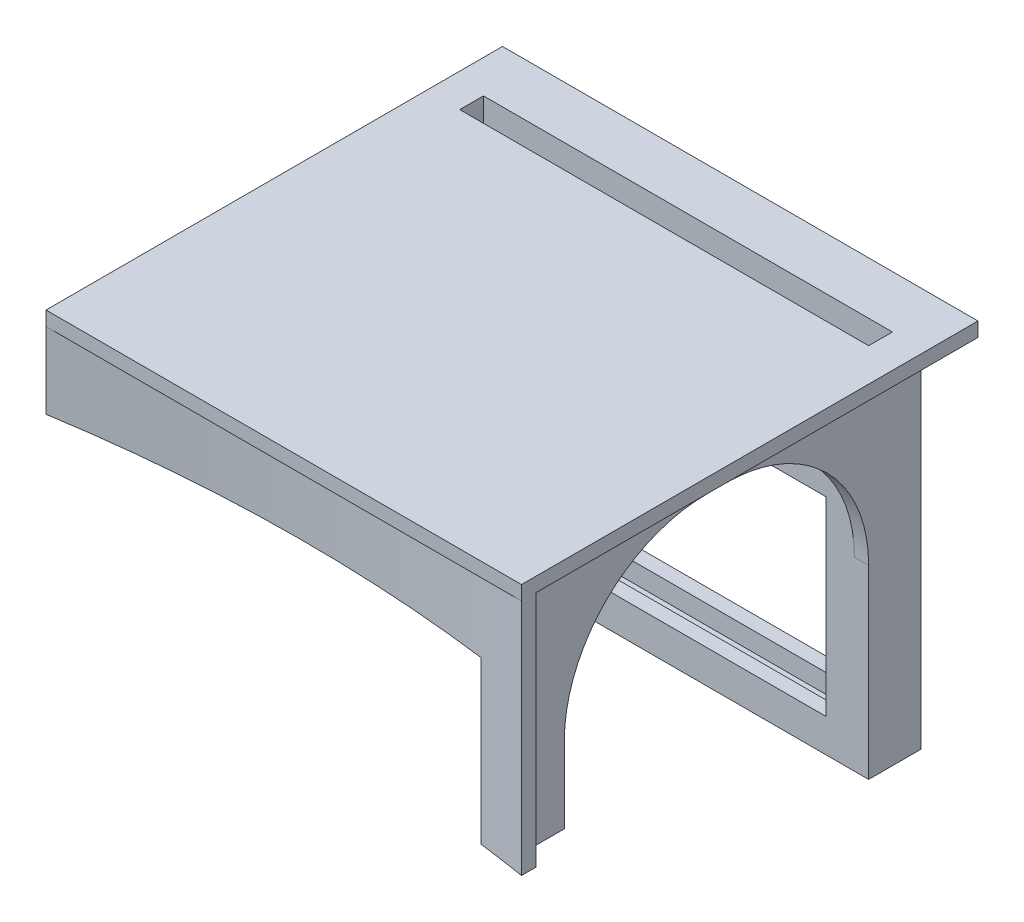
from build123d import *

# Parameters (mm, degrees)
SKETCH_1_W          = 50
SKETCH_1_H          = 48
SKETCH_1_W_2        = 43
SKETCH_1_H_2        = 2.5
EXTRUDE_1_DEPTH     = 1.5
SKETCH_2_W          = 46
SKETCH_2_H          = 5.5
SKETCH_2_W_2        = 43
SKETCH_2_H_2        = 2.5
EXTRUDE_2_DEPTH     = 35
SKETCH_3_W          = 46
SKETCH_3_H          = 5.5
EXTRUDE_3_DEPTH     = 1.5
SKETCH_4_W          = 37
SKETCH_4_H          = 20
CUT_EXTRUDE_1_DEPTH = 5.5
EXTRUDE_4_DEPTH     = 25
EXTRUDE_5_DEPTH     = 1.5
CUT_EXTRUDE_2_REACH = 80.334
SKETCH_7_W          = 45
SKETCH_7_H          = 17


with BuildPart() as part:
    # 草图1 → 凸台-拉伸1 (new body)
    with BuildSketch(Plane(origin=(0, 0, 0), x_dir=(1, 0, 0), z_dir=(0, 1, 0))):
        with Locations((25, 24)):
            Rectangle(SKETCH_1_W, SKETCH_1_H)
        with Locations((25, 41.25)):
            Rectangle(SKETCH_1_W_2, SKETCH_1_H_2, mode=Mode.SUBTRACT)
    extrude(amount=EXTRUDE_1_DEPTH)

    # 草图2 → 凸台-拉伸2 (add)
    with BuildSketch(Plane.XZ):
        with Locations((25, -41.25)):
            Rectangle(SKETCH_2_W, SKETCH_2_H)
        with Locations((25, -41.25)):
            Rectangle(SKETCH_2_W_2, SKETCH_2_H_2, mode=Mode.SUBTRACT)
    extrude(amount=EXTRUDE_2_DEPTH)

    # 草图3 → 凸台-拉伸3 (add)
    with BuildSketch(Plane.XZ.offset(35)):
        with Locations((25, -41.25)):
            Rectangle(SKETCH_3_W, SKETCH_3_H)
    extrude(amount=EXTRUDE_3_DEPTH)

    # 草图4 → 切除-拉伸1 (cut)
    with BuildSketch(Plane(origin=(0, 0, -44), x_dir=(-1, 0, 0), z_dir=(0, 0, -1))):
        with Locations((-25, -23)):
            Rectangle(SKETCH_4_W, SKETCH_4_H)
    extrude(amount=-CUT_EXTRUDE_1_DEPTH, mode=Mode.SUBTRACT)

    # 草图5 → 凸台-拉伸4 (add)
    with BuildSketch(Plane.XZ):
        with BuildLine():
            Line((50, 0), (50, -1.5))
            ThreePointArc((50, -1.5), (25, -3.481101237), (0, -1.5))
            Line((0, -1.5), (0, 0))
            ThreePointArc((0, 0), (25, -2), (50, 0))
        make_face()
    extrude(amount=EXTRUDE_4_DEPTH)

    # 草图6 → 凸台-拉伸5 (add)
    with BuildSketch(Plane(origin=(48, 0, 0), x_dir=(0, 0, -1), z_dir=(1, 0, 0))):
        with BuildLine():
            Line((44, 0), (1.5, 0))
            Line((1.5, 0), (1.5, -25))
            Line((1.5, -25), (6.5, -25))
            Line((6.5, -25), (6.5, -17))
            ThreePointArc((6.5, -17), (10.893398282, -6.393398282), (21.5, -2))
            Line((21.5, -2), (23.5, -2))
            ThreePointArc((23.5, -2), (34.106601718, -6.393398282), (38.5, -17))
            Line((38.5, -17), (38.5, -25))
            Line((38.5, -25), (44, -25))
            Line((44, -25), (44, 0))
        make_face()
    extrude(amount=-EXTRUDE_5_DEPTH)

    # 草图7 → 切除-拉伸2 (cut, up to next)
    with BuildSketch(Plane.XY, mode=Mode.PRIVATE) as cut_extrude_2_sk1:
        with Locations((22.5, -16.5)):
            Rectangle(SKETCH_7_W, SKETCH_7_H)
    cut_extrude_2_tool1 = extrude(cut_extrude_2_sk1.sketch, amount=-CUT_EXTRUDE_2_REACH, mode=Mode.PRIVATE) & part.part
    add(cut_extrude_2_tool1.solids().sort_by_distance((22.5, -16.5, 0))[0], mode=Mode.SUBTRACT)


solid = part.part
